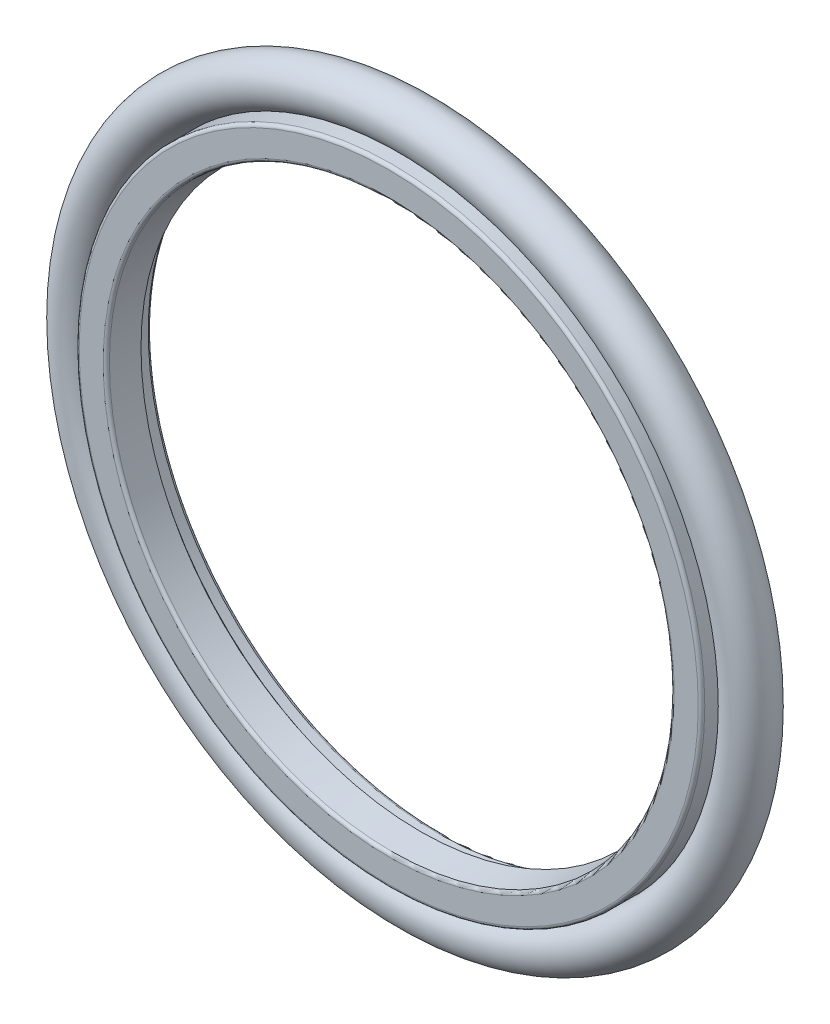
from build123d import *

# Parameters (mm, degrees)
SKETCH2_R = 1.75


with BuildPart() as part:
    # Sketch1 → Revolve1 (revolve)
    with BuildSketch(Plane(origin=(0, 0, 0), x_dir=(0, 0, -1), z_dir=(1, 0, 0))):
        with BuildLine():
            Line((0.25, 23.8), (3.75, 23.8))
            ThreePointArc((3.75, 23.8), (3.926776695, 23.726776695), (4, 23.55))
            Line((4, 23.55), (4, 22.3))
            ThreePointArc((4, 22.3), (3.926776695, 22.123223305), (3.75, 22.05))
            Line((3.75, 22.05), (3, 22.05))
            Line((3, 22.05), (2.4, 21.25))
            Line((2.4, 21.25), (0.224098479, 21.476656408))
            ThreePointArc((0.224098479, 21.476656408), (0.064291384, 21.557942227), (0, 21.725311011))
            Line((0, 21.725311011), (0, 23.55))
            ThreePointArc((0, 23.55), (0.073223305, 23.726776695), (0.25, 23.8))
        make_face()
    revolve(axis=Axis((0, 0, 0), (0, 0, -1)))


with BuildPart() as body_2:
    # Sketch2 → Revolve2 (revolve)
    with BuildSketch(Plane(origin=(0, 0, 0), x_dir=(0, 0, -1), z_dir=(1, 0, 0))):
        with Locations((2, 25.55)):
            Circle(SKETCH2_R)
    revolve(axis=Axis((0, 0, 0), (0, 0, -1)))


solid = Compound([part.part, body_2.part])
